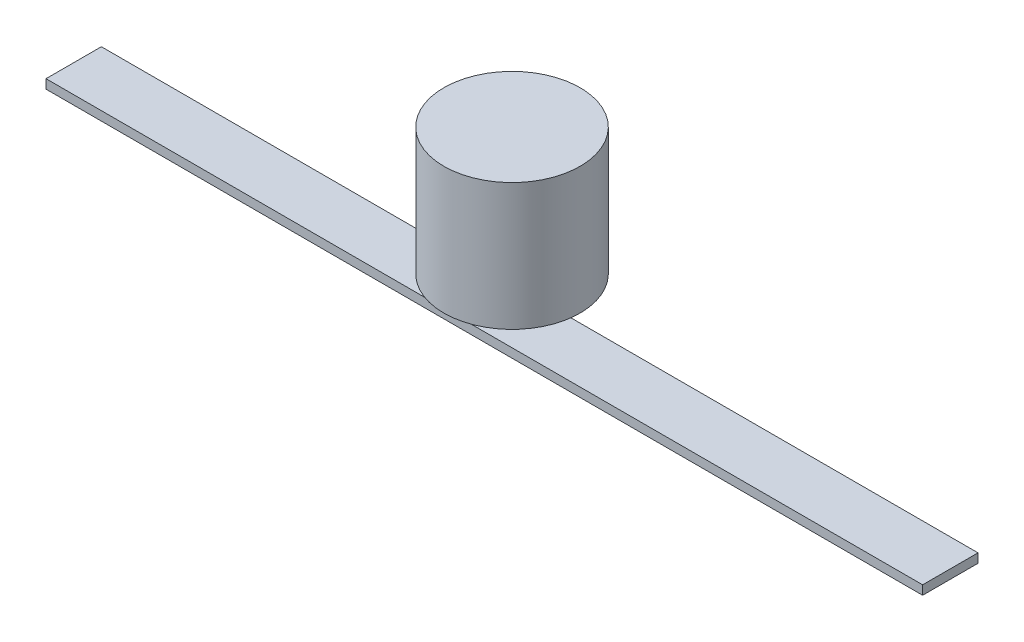
from build123d import *

# Parameters (mm, degrees)
SKETCH1_W           = 482.6
SKETCH1_H           = 30.48
BOSS_EXTRUDE1_DEPTH = 5
SKETCH2_R           = 7.5
BOSS_EXTRUDE2_DEPTH = 20
SKETCH3_R           = 37.5
BOSS_EXTRUDE3_DEPTH = 70


with BuildPart() as part:
    # Sketch1 → Boss-Extrude1 (new body)
    with BuildSketch(Plane(origin=(0, 0, 0), x_dir=(1, 0, 0), z_dir=(0, 1, 0))):
        Rectangle(SKETCH1_W, SKETCH1_H)
    extrude(amount=BOSS_EXTRUDE1_DEPTH)

    # Sketch2 → Boss-Extrude2 (add)
    with BuildSketch(Plane(origin=(0, 5, 0), x_dir=(1, 0, 0), z_dir=(0, 1, 0))):
        Circle(SKETCH2_R)
    extrude(amount=BOSS_EXTRUDE2_DEPTH)

    # Sketch3 → Boss-Extrude3 (add)
    with BuildSketch(Plane(origin=(0, 25, 0), x_dir=(1, 0, 0), z_dir=(0, 1, 0))):
        Circle(SKETCH3_R)
    extrude(amount=BOSS_EXTRUDE3_DEPTH)


solid = part.part
